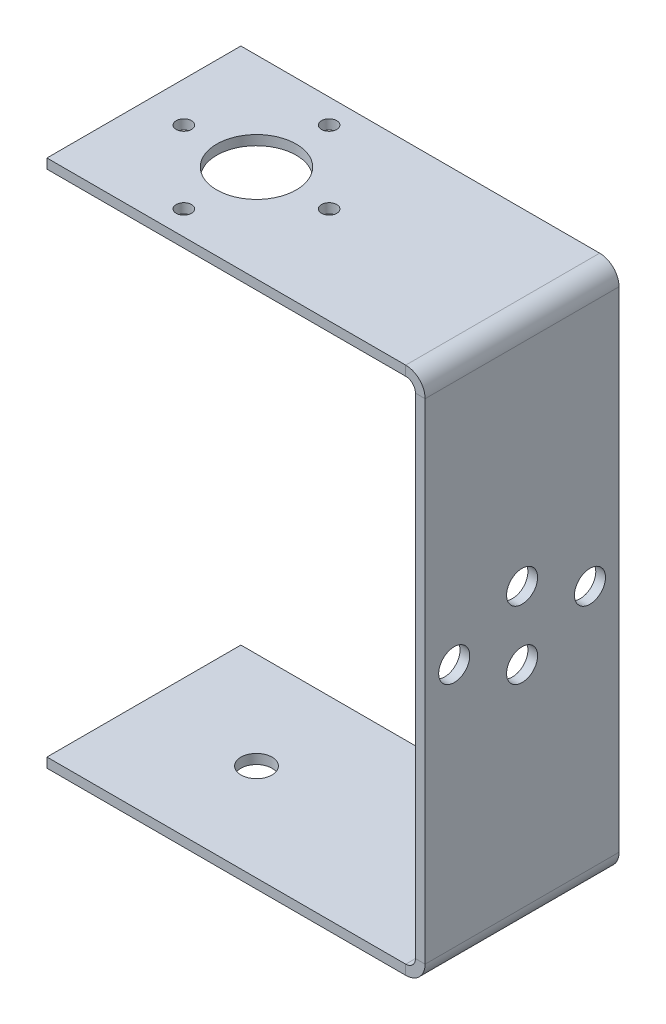
from build123d import *

# Parameters (mm, degrees)
SKETCH_1_W                    = 20
SKETCH_1_H                    = 54.5
EXTRUDE_1_DEPTH               = 1
SKETCH_2_W                    = 20
SKETCH_2_H                    = 1
EXTRUDE_2_DEPTH               = 38
SKETCH_3_W                    = 20
SKETCH_3_H                    = 1
EXTRUDE_3_DEPTH               = 38
SKETCH_4_R                    = 4.1
CUT_EXTRUDE_1_DEPTH           = 1
SKETCH_5_R                    = 0.79
CUT_EXTRUDE_2_DEPTH           = 1
SKETCH_6_R                    = 0.79
CUT_EXTRUDE_3_DEPTH           = 1
SKETCH_7_R                    = 0.79
CUT_EXTRUDE_4_DEPTH           = 1
SKETCH_8_R                    = 0.79
CUT_EXTRUDE_5_DEPTH           = 1
SKETCH_9_R                    = 1.6
CUT_EXTRUDE_6_DEPTH           = 1
CUT_EXTRUDE_7_REACH           = 71.937
SKETCH_10_R                   = 1.6
CUT_EXTRUDE_8_REACH           = 71.937
SKETCH_11_R                   = 1.6
CUT_EXTRUDE_9_REACH           = 71.937
SKETCH_12_R                   = 1.6
CUT_EXTRUDE_10_REACH          = 71.937
SKETCH_14_R                   = 1.6
SHEET_START                   = -38
SHEET_METAL_1_OUTLINE_W       = 1
SHEET_METAL_1_OUTLINE_H       = 20
SHEET_METAL_1_DEPTH           = 38
SHEET_METAL_1_2_OUTLINE_W     = 37.35619449
SHEET_METAL_1_2_OUTLINE_H     = 20
SHEET_METAL_1_2_OUTLINE_R     = 0.79
SHEET_METAL_1_2_OUTLINE_R_2   = 4.1
SHEET_METAL_1_2_OUTLINE_R_3   = 1.6
SHEET_METAL_1_2_DEPTH         = 1
SHEET_START_2                 = 54.28876
SHEET_METAL_1_3_OUTLINE_W     = 1
SHEET_METAL_1_3_OUTLINE_H     = 20
SHEET_METAL_1_3_DEPTH         = 37.56743449
SHEET_START_3                 = -37.35619449
SHEET_METAL_1_3_2_OUTLINE_W   = 1
SHEET_METAL_1_3_2_OUTLINE_H   = 20
SHEET_METAL_1_3_2_DEPTH       = 37.55071449
SHEET_METAL_1_3_3_OUTLINE_R   = 4.1
SHEET_METAL_1_3_3_OUTLINE_R_2 = 1.6
SHEET_METAL_1_3_3_OUTLINE_R_3 = 0.79
SHEET_METAL_1_3_3_DEPTH       = 1
SHEET_METAL_1_3_4_OUTLINE_W   = 38
SHEET_METAL_1_3_4_OUTLINE_H   = 20
SHEET_METAL_1_3_4_OUTLINE_R   = 0.79
SHEET_METAL_1_3_4_OUTLINE_R_2 = 4.1
SHEET_METAL_1_3_4_DEPTH       = 2
SHEET_START_4                 = 52.5
SHEET_METAL_1_3_5_OUTLINE_W   = 38
SHEET_METAL_1_3_5_OUTLINE_H   = 20
SHEET_METAL_1_3_5_OUTLINE_R   = 0.79
SHEET_METAL_1_3_5_OUTLINE_R_2 = 4.1
SHEET_METAL_1_3_5_DEPTH       = 2
SHEET_START_5                 = -20
SHEET_METAL_1_3_6_DEPTH       = 20


with BuildPart() as part:
    # Sketch 1 → ﾎﾞｽ - 押し出し1 (new body)
    with BuildSketch(Plane(origin=(0, 0, 0), x_dir=(0, 0, -1), z_dir=(1, 0, 0))):
        with Locations((10, 27.25)):
            Rectangle(SKETCH_1_W, SKETCH_1_H)
    extrude(amount=EXTRUDE_1_DEPTH)

    # Sketch 2 → ﾎﾞｽ - 押し出し2 (add)
    with BuildSketch(Plane.ZY):
        with Locations((-10, 54)):
            Rectangle(SKETCH_2_W, SKETCH_2_H)
    extrude(amount=EXTRUDE_2_DEPTH)

    # ｽｹｯﾁ3 → ﾎﾞｽ - 押し出し3 (add)
    with BuildSketch(Plane.ZY):
        with Locations((-10, 0.5)):
            Rectangle(SKETCH_3_W, SKETCH_3_H)
    extrude(amount=EXTRUDE_3_DEPTH)

    # ｽｹｯﾁ4 → ｶｯﾄ - 押し出し1 (cut)
    with BuildSketch(Plane(origin=(0, 54.5, 0), x_dir=(1, 0, 0), z_dir=(0, 1, 0))):
        with Locations(Location((-26.39, 10, 0), (0, 0, 270))):
            Circle(SKETCH_4_R)
    extrude(amount=-CUT_EXTRUDE_1_DEPTH, mode=Mode.SUBTRACT)

    # ｽｹｯﾁ5 → ｶｯﾄ - 押し出し2 (cut)
    with BuildSketch(Plane(origin=(0, 54.5, 0), x_dir=(1, 0, 0), z_dir=(0, 1, 0))):
        with Locations(Location((-33.88, 10, 0), (0, 0, 270))):
            Circle(SKETCH_5_R)
    extrude(amount=-CUT_EXTRUDE_2_DEPTH, mode=Mode.SUBTRACT)

    # ｽｹｯﾁ6 → ｶｯﾄ - 押し出し3 (cut)
    with BuildSketch(Plane(origin=(0, 54.5, 0), x_dir=(1, 0, 0), z_dir=(0, 1, 0))):
        with Locations(Location((-18.9, 10, 0), (0, 0, 270))):
            Circle(SKETCH_6_R)
    extrude(amount=-CUT_EXTRUDE_3_DEPTH, mode=Mode.SUBTRACT)

    # ｽｹｯﾁ7 → ｶｯﾄ - 押し出し4 (cut)
    with BuildSketch(Plane(origin=(0, 54.5, 0), x_dir=(1, 0, 0), z_dir=(0, 1, 0))):
        with Locations(Location((-26.39, 2.51, 0), (0, 0, 270))):
            Circle(SKETCH_7_R)
    extrude(amount=-CUT_EXTRUDE_4_DEPTH, mode=Mode.SUBTRACT)

    # ｽｹｯﾁ8 → ｶｯﾄ - 押し出し5 (cut)
    with BuildSketch(Plane(origin=(0, 54.5, 0), x_dir=(1, 0, 0), z_dir=(0, 1, 0))):
        with Locations(Location((-26.39, 17.49, 0), (0, 0, 270))):
            Circle(SKETCH_8_R)
    extrude(amount=-CUT_EXTRUDE_5_DEPTH, mode=Mode.SUBTRACT)

    # ｽｹｯﾁ9 → ｶｯﾄ - 押し出し6 (cut)
    with BuildSketch(Plane(origin=(0, 0, 0), x_dir=(-1, 0, 0), z_dir=(0, -1, 0))):
        with Locations(Location((26.39, 10, 0), (0, 0, 90))):
            Circle(SKETCH_9_R)
    extrude(amount=-CUT_EXTRUDE_6_DEPTH, mode=Mode.SUBTRACT)

    # ｽｹｯﾁ10 → ｶｯﾄ - 押し出し7 (cut, up to next)
    with BuildSketch(Plane(origin=(1, 0, 0), x_dir=(0, 0, -1), z_dir=(1, 0, 0)), mode=Mode.PRIVATE) as cut_extrude_7_sk1:
        with Locations((17, 27.25)):
            Circle(SKETCH_10_R)
    cut_extrude_7_tool1 = extrude(cut_extrude_7_sk1.sketch, amount=-CUT_EXTRUDE_7_REACH, mode=Mode.PRIVATE) & part.part
    add(cut_extrude_7_tool1.solids().sort_by_distance((1, 27.25, -17))[0], mode=Mode.SUBTRACT)

    # ｽｹｯﾁ11 → ｶｯﾄ - 押し出し8 (cut, up to next)
    with BuildSketch(Plane(origin=(1, 0, 0), x_dir=(0, 0, -1), z_dir=(1, 0, 0)), mode=Mode.PRIVATE) as cut_extrude_8_sk1:
        with Locations((3, 27.25)):
            Circle(SKETCH_11_R)
    cut_extrude_8_tool1 = extrude(cut_extrude_8_sk1.sketch, amount=-CUT_EXTRUDE_8_REACH, mode=Mode.PRIVATE) & part.part
    add(cut_extrude_8_tool1.solids().sort_by_distance((1, 27.25, -3))[0], mode=Mode.SUBTRACT)

    # ｽｹｯﾁ12 → ｶｯﾄ - 押し出し9 (cut, up to next)
    with BuildSketch(Plane(origin=(1, 0, 0), x_dir=(0, 0, -1), z_dir=(1, 0, 0)), mode=Mode.PRIVATE) as cut_extrude_9_sk1:
        with Locations((10, 23.75)):
            Circle(SKETCH_12_R)
    cut_extrude_9_tool1 = extrude(cut_extrude_9_sk1.sketch, amount=-CUT_EXTRUDE_9_REACH, mode=Mode.PRIVATE) & part.part
    add(cut_extrude_9_tool1.solids().sort_by_distance((1, 23.75, -10))[0], mode=Mode.SUBTRACT)

    # ｽｹｯﾁ14 → ｶｯﾄ - 押し出し10 (cut, up to next)
    with BuildSketch(Plane(origin=(1, 0, 0), x_dir=(0, 0, -1), z_dir=(1, 0, 0)), mode=Mode.PRIVATE) as cut_extrude_10_sk1:
        with Locations((10, 30.75)):
            Circle(SKETCH_14_R)
    cut_extrude_10_tool1 = extrude(cut_extrude_10_sk1.sketch, amount=-CUT_EXTRUDE_10_REACH, mode=Mode.PRIVATE) & part.part
    add(cut_extrude_10_tool1.solids().sort_by_distance((1, 30.75, -10))[0], mode=Mode.SUBTRACT)

    # Sheet Metal 1: read off the stored shape, not the designer's step
    # Sheet Metal 1 outline → Sheet Metal 1 (cut)
    with BuildSketch(Plane.YZ.offset(SHEET_START)):
        with Locations((54, -10)):
            Rectangle(SHEET_METAL_1_OUTLINE_W, SHEET_METAL_1_OUTLINE_H)
        with Locations((0.5, -10)):
            Rectangle(SHEET_METAL_1_OUTLINE_W, SHEET_METAL_1_OUTLINE_H)
    extrude(amount=SHEET_METAL_1_DEPTH, mode=Mode.SUBTRACT)

    # Sheet Metal 1 2 outline → Sheet Metal 1 2 (add)
    # profile 1 of 2: a face of its own
    with BuildSketch(Plane.YZ):
        with Locations((73.178097245, -10)):
            Rectangle(SHEET_METAL_1_2_OUTLINE_W, SHEET_METAL_1_2_OUTLINE_H)
        with Locations((80.24619449, -17.49)):
            Circle(SHEET_METAL_1_2_OUTLINE_R, mode=Mode.SUBTRACT)
        with Locations((72.75619449, -10)):
            Circle(SHEET_METAL_1_2_OUTLINE_R, mode=Mode.SUBTRACT)
        with Locations((80.24619449, -10)):
            Circle(SHEET_METAL_1_2_OUTLINE_R_2, mode=Mode.SUBTRACT)
        with Locations((87.73619449, -10)):
            Circle(SHEET_METAL_1_2_OUTLINE_R, mode=Mode.SUBTRACT)
        with Locations((80.24619449, -2.51)):
            Circle(SHEET_METAL_1_2_OUTLINE_R, mode=Mode.SUBTRACT)
    # profile 2 of 2: a face of its own
    with BuildSketch(Plane.YZ):
        with Locations((-18.678097245, -10)):
            Rectangle(SHEET_METAL_1_2_OUTLINE_W, SHEET_METAL_1_2_OUTLINE_H)
        with Locations((-25.74619449, -10)):
            Circle(SHEET_METAL_1_2_OUTLINE_R_3, mode=Mode.SUBTRACT)
    extrude(amount=SHEET_METAL_1_2_DEPTH)

    # Sheet Metal 1 3: read off the stored shape, not the designer's step
    # Sheet Metal 1 3 outline → Sheet Metal 1 3 (cut)
    with BuildSketch(Plane(origin=(0, 0, 0), x_dir=(1, 0, 0), z_dir=(0, 1, 0)).offset(SHEET_START_2)):
        with Locations((0.5, 10)):
            Rectangle(SHEET_METAL_1_3_OUTLINE_W, SHEET_METAL_1_3_OUTLINE_H)
    extrude(amount=SHEET_METAL_1_3_DEPTH, mode=Mode.SUBTRACT)

    # Sheet Metal 1 3 2 outline → Sheet Metal 1 3 2 (cut)
    with BuildSketch(Plane(origin=(0, 0, 0), x_dir=(1, 0, 0), z_dir=(0, 1, 0)).offset(SHEET_START_3)):
        with Locations((0.5, 10)):
            Rectangle(SHEET_METAL_1_3_2_OUTLINE_W, SHEET_METAL_1_3_2_OUTLINE_H)
    extrude(amount=SHEET_METAL_1_3_2_DEPTH, mode=Mode.SUBTRACT)



with BuildPart() as body_2:
    # Sheet Metal 1 3 3 outline → Sheet Metal 1 3 3 (new body)
    # profile 1 of 5: a face of its own
    with BuildSketch(Plane(origin=(0, 0, 0), x_dir=(1, 0, 0), z_dir=(0, 1, 0))):
        with Locations((-26.39, 10)):
            Circle(SHEET_METAL_1_3_3_OUTLINE_R)
        with Locations((-26.39, 10)):
            Circle(SHEET_METAL_1_3_3_OUTLINE_R_2, mode=Mode.SUBTRACT)
    # profile 2 of 5: a face of its own
    with BuildSketch(Plane(origin=(0, 0, 0), x_dir=(1, 0, 0), z_dir=(0, 1, 0))):
        with Locations((-33.88, 10)):
            Circle(SHEET_METAL_1_3_3_OUTLINE_R_3)
    # profile 3 of 5: a face of its own
    with BuildSketch(Plane(origin=(0, 0, 0), x_dir=(1, 0, 0), z_dir=(0, 1, 0))):
        with Locations((-18.9, 10)):
            Circle(SHEET_METAL_1_3_3_OUTLINE_R_3)
    # profile 4 of 5: a face of its own
    with BuildSketch(Plane(origin=(0, 0, 0), x_dir=(1, 0, 0), z_dir=(0, 1, 0))):
        with Locations((-26.39, 2.51)):
            Circle(SHEET_METAL_1_3_3_OUTLINE_R_3)
    # profile 5 of 5: a face of its own
    with BuildSketch(Plane(origin=(0, 0, 0), x_dir=(1, 0, 0), z_dir=(0, 1, 0))):
        with Locations((-26.39, 17.49)):
            Circle(SHEET_METAL_1_3_3_OUTLINE_R_3)
    extrude(amount=SHEET_METAL_1_3_3_DEPTH)


with BuildPart() as part_1:
    add(part.part)

    add(body_2.part)  # Sheet Metal 1 3 4 merges body 2
    # Sheet Metal 1 3 4 outline → Sheet Metal 1 3 4 (add)
    with BuildSketch(Plane(origin=(0, 0, 0), x_dir=(1, 0, 0), z_dir=(0, 1, 0))):
        with Locations((-19, 10)):
            Rectangle(SHEET_METAL_1_3_4_OUTLINE_W, SHEET_METAL_1_3_4_OUTLINE_H)
        with Locations((-26.39, 2.51)):
            Circle(SHEET_METAL_1_3_4_OUTLINE_R, mode=Mode.SUBTRACT)
        with Locations((-33.88, 10)):
            Circle(SHEET_METAL_1_3_4_OUTLINE_R, mode=Mode.SUBTRACT)
        with Locations((-26.39, 10)):
            Circle(SHEET_METAL_1_3_4_OUTLINE_R_2, mode=Mode.SUBTRACT)
        with Locations((-18.9, 10)):
            Circle(SHEET_METAL_1_3_4_OUTLINE_R, mode=Mode.SUBTRACT)
        with Locations((-26.39, 17.49)):
            Circle(SHEET_METAL_1_3_4_OUTLINE_R, mode=Mode.SUBTRACT)
    extrude(amount=SHEET_METAL_1_3_4_DEPTH)

    # Sheet Metal 1 3 5 outline → Sheet Metal 1 3 5 (add)
    with BuildSketch(Plane(origin=(0, 0, 0), x_dir=(1, 0, 0), z_dir=(0, 1, 0)).offset(SHEET_START_4)):
        with Locations((-19, 10)):
            Rectangle(SHEET_METAL_1_3_5_OUTLINE_W, SHEET_METAL_1_3_5_OUTLINE_H)
        with Locations((-26.39, 2.51)):
            Circle(SHEET_METAL_1_3_5_OUTLINE_R, mode=Mode.SUBTRACT)
        with Locations((-33.88, 10)):
            Circle(SHEET_METAL_1_3_5_OUTLINE_R, mode=Mode.SUBTRACT)
        with Locations((-26.39, 10)):
            Circle(SHEET_METAL_1_3_5_OUTLINE_R_2, mode=Mode.SUBTRACT)
        with Locations((-18.9, 10)):
            Circle(SHEET_METAL_1_3_5_OUTLINE_R, mode=Mode.SUBTRACT)
        with Locations((-26.39, 17.49)):
            Circle(SHEET_METAL_1_3_5_OUTLINE_R, mode=Mode.SUBTRACT)
    extrude(amount=SHEET_METAL_1_3_5_DEPTH)

    # Sheet Metal 1 3 6 outline → Sheet Metal 1 3 6 (cut)
    with BuildSketch(Plane.XY.offset(SHEET_START_5)):
        with BuildLine():
            Line((-38, 2), (-38, 1))
            Line((-38, 1), (-1, 1))
            ThreePointArc((-1, 1), (-0.292893219, 1.292893219), (0, 2))
            Line((0, 2), (-38, 2))
        make_face()
        with BuildLine():
            Line((-1, 53.5), (-38, 53.5))
            Line((-38, 53.5), (-38, 52.5))
            Line((-38, 52.5), (0, 52.5))
            ThreePointArc((0, 52.5), (-0.292893219, 53.207106781), (-1, 53.5))
        make_face()
        with BuildLine():
            ThreePointArc((-1, 54.5), (0.414213562, 53.914213562), (1, 52.5))
            Line((1, 52.5), (1, 54.28876))
            Line((1, 54.28876), (0, 54.28876))
            Line((0, 54.28876), (0, 54.5))
            Line((0, 54.5), (-1, 54.5))
        make_face()
        with BuildLine():
            ThreePointArc((1, 2), (0.414213562, 0.585786438), (-1, 0))
            Line((-1, 0), (0, 0))
            Line((0, 0), (0, 0.19452))
            Line((0, 0.19452), (1, 0.19452))
            Line((1, 0.19452), (1, 2))
        make_face()
    extrude(amount=SHEET_METAL_1_3_6_DEPTH, mode=Mode.SUBTRACT)


solid = part_1.part
